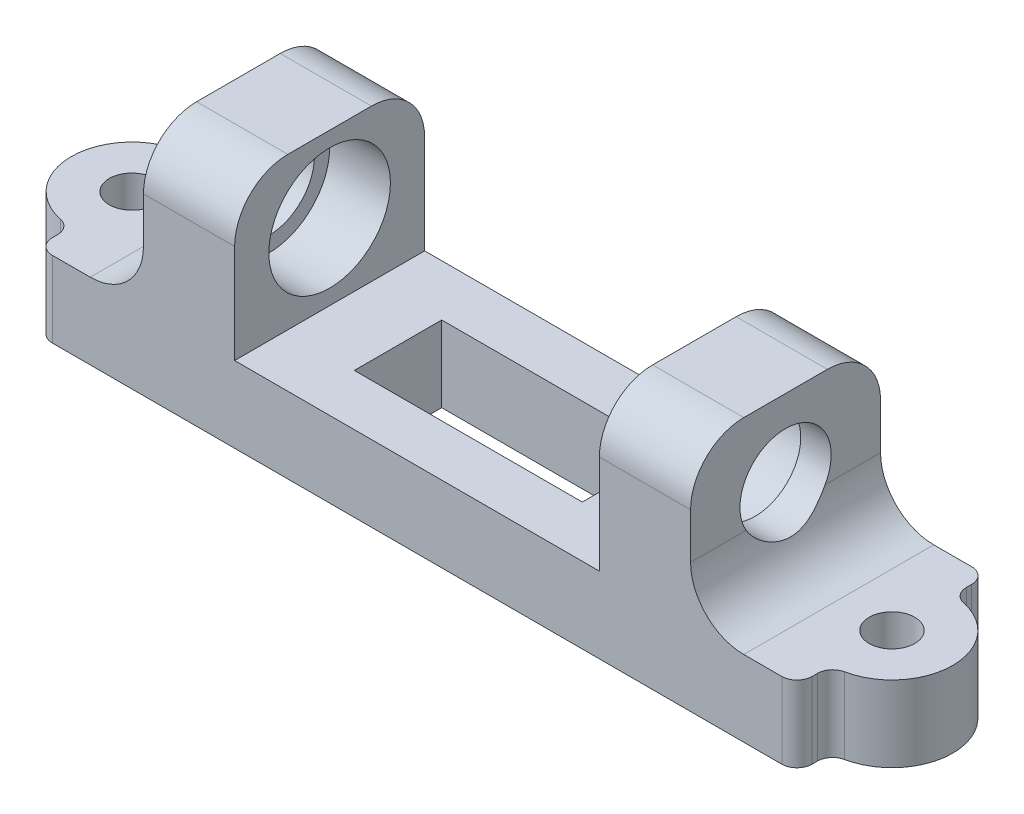
from build123d import *

# Parameters (mm, degrees)
SKETCH1_R           = 1.5
BOSS_EXTRUDE1_DEPTH = 5
BOSS_EXTRUDE2_DEPTH = 10
SKETCH3_R           = 4
CUT_EXTRUDE1_DEPTH  = 4
SKETCH3_3_R         = 3
CUT_EXTRUDE2_DEPTH  = 45.102862719
FILLET6_R           = 3.5
FILLET7_R           = 3.5
FILLET8_R           = 3.5
FILLET9_R           = 3.5
FILLET10_R          = 3.5
FILLET11_R          = 3.5
FILLET12_R          = 1
FILLET13_R          = 1
FILLET14_R          = 1
FILLET15_R          = 1
FILLET16_R          = 1
FILLET17_R          = 1
FILLET18_R          = 1
FILLET19_R          = 1
SKETCH4_W           = 15
SKETCH4_H           = 5.75
CUT_EXTRUDE3_DEPTH  = 32.305949934


with BuildPart() as part:
    # Sketch1 → Boss-Extrude1 (new body)
    with BuildSketch(Plane(origin=(0, 0, 0), x_dir=(1, 0, 0), z_dir=(0, 1, 0))):
        with BuildLine():
            Line((-25, -4), (-25, -6.25))
            Line((-25, -6.25), (25, -6.25))
            Line((25, -6.25), (25, -4))
            ThreePointArc((25, -4), (29, 0), (25, 4))
            Line((25, 4), (25, 6.25))
            Line((25, 6.25), (-25, 6.25))
            Line((-25, 6.25), (-25, 4))
            ThreePointArc((-25, 4), (-29, 0), (-25, -4))
        make_face()
        with Locations(Location((25, 0, 0), (0, 0, 270))):
            Circle(SKETCH1_R, mode=Mode.SUBTRACT)
        with Locations(Location((-25, 0, 0), (0, 0, 270))):
            Circle(SKETCH1_R, mode=Mode.SUBTRACT)
    extrude(amount=BOSS_EXTRUDE1_DEPTH)

    # Sketch2 → Boss-Extrude2 (add)
    with BuildSketch(Plane(origin=(0, 5, 0), x_dir=(1, 0, 0), z_dir=(0, 1, 0))):
        Polygon((-18, 0), (-18, -6.25), (-12, -6.25), (-12, 6.25), (-18, 6.25), align=None)
    boss_extrude2 = extrude(amount=BOSS_EXTRUDE2_DEPTH)

    # Sketch3 → Cut-Extrude1 (cut)
    with BuildSketch(Plane(origin=(-12, 0, 0), x_dir=(0, 0, -1), z_dir=(1, 0, 0))):
        with Locations((0, 10)):
            Circle(SKETCH3_R)
    cut_extrude1 = extrude(amount=-CUT_EXTRUDE1_DEPTH, mode=Mode.SUBTRACT)

    # Sketch3<3> → Cut-Extrude2 (cut, through all)
    with BuildSketch(Plane(origin=(-12, 0, 0), x_dir=(0, 0, -1), z_dir=(1, 0, 0))):
        with Locations((0, 10)):
            Circle(SKETCH3_3_R)
    cut_extrude2 = extrude(amount=-CUT_EXTRUDE2_DEPTH, mode=Mode.SUBTRACT)

    # Fillet6
    # the kernel refuses this fillet: 3.5 mm, written as the material it adds along each edge
    with BuildSketch(Plane(origin=(-18, 5, -6.25), x_dir=(0, 1, 0), z_dir=(0, 0, 1))) as fillet6_piece_1_section:
        with BuildLine():
            CenterArc((FILLET6_R, FILLET6_R), FILLET6_R, 180, 90)
            Line((0, FILLET6_R), (0, 0))
            Line((0, 0), (FILLET6_R, 0))
        make_face()
    fillet6_piece_1 = extrude(amount=12.5, mode=Mode.PRIVATE)
    fillet6_piece_1 = fillet6_piece_1 - Plane(origin=(-18.808785758, 10, 0), x_dir=(0, 0, -1), z_dir=(1, 0, 0)) * Cylinder(3, 39, mode=Mode.PRIVATE)
    add(fillet6_piece_1)

    # Fillet7
    fillet7_edges = [part.edges().sort_by_distance(p)[0] for p in [
        (-15, 15, -6.25),
    ]]
    fillet(fillet7_edges, radius=FILLET7_R)

    # Fillet8
    fillet8_edges = [part.edges().sort_by_distance(p)[0] for p in [
        (-15, 15, 6.25),
    ]]
    fillet(fillet8_edges, radius=FILLET8_R)

    # Mirror4: Boss-Extrude2, Cut-Extrude1, Cut-Extrude2 across plane
    add(boss_extrude2.mirror(Plane(origin=(0, 0, 0), x_dir=(0, 0, 1), z_dir=(1, 0, 0))))
    add(cut_extrude1.mirror(Plane(origin=(0, 0, 0), x_dir=(0, 0, 1), z_dir=(1, 0, 0))), mode=Mode.SUBTRACT)
    add(cut_extrude2.mirror(Plane(origin=(0, 0, 0), x_dir=(0, 0, 1), z_dir=(1, 0, 0))), mode=Mode.SUBTRACT)

    # Fillet9
    fillet9_edges = [part.edges().sort_by_distance(p)[0] for p in [
        (15, 15, -6.25),
    ]]
    fillet(fillet9_edges, radius=FILLET9_R)

    # Fillet10
    fillet10_edges = [part.edges().sort_by_distance(p)[0] for p in [
        (15, 15, 6.25),
    ]]
    fillet(fillet10_edges, radius=FILLET10_R)

    # Fillet11
    # the kernel refuses this fillet: 3.5 mm, written as the material it adds along each edge
    with BuildSketch(Plane(origin=(18, 5, -6.25), x_dir=(0, 1, 0), z_dir=(0, 0, 1))) as fillet11_piece_1_section:
        with BuildLine():
            CenterArc((FILLET11_R, -FILLET11_R), FILLET11_R, 90, 90)
            Line((0, -FILLET11_R), (0, 0))
            Line((0, 0), (FILLET11_R, 0))
        make_face()
    fillet11_piece_1 = extrude(amount=12.5, mode=Mode.PRIVATE)
    fillet11_piece_1 = fillet11_piece_1 - Plane(origin=(18.808785758, 10, 0), x_dir=(0, 0, -1), z_dir=(-1, 0, 0)) * Cylinder(3, 39, mode=Mode.PRIVATE)
    add(fillet11_piece_1)

    # Fillet12
    fillet12_edges = [part.edges().sort_by_distance(p)[0] for p in [
        (25, 2.5, -6.25),
    ]]
    fillet(fillet12_edges, radius=FILLET12_R)

    # Fillet13
    fillet13_edges = [part.edges().sort_by_distance(p)[0] for p in [
        (25, 2.5, 6.25),
    ]]
    fillet(fillet13_edges, radius=FILLET13_R)

    # Fillet14
    fillet14_edges = [part.edges().sort_by_distance(p)[0] for p in [
        (-25, 2.5, 6.25),
    ]]
    fillet(fillet14_edges, radius=FILLET14_R)

    # Fillet15
    fillet15_edges = [part.edges().sort_by_distance(p)[0] for p in [
        (-25, 2.5, -6.25),
    ]]
    fillet(fillet15_edges, radius=FILLET15_R)

    # Fillet16
    fillet16_edges = [part.edges().sort_by_distance(p)[0] for p in [
        (-25, 2.5, -4),
    ]]
    fillet(fillet16_edges, radius=FILLET16_R)

    # Fillet17
    fillet17_edges = [part.edges().sort_by_distance(p)[0] for p in [
        (-25, 2.5, 4),
    ]]
    fillet(fillet17_edges, radius=FILLET17_R)

    # Fillet18
    fillet18_edges = [part.edges().sort_by_distance(p)[0] for p in [
        (25, 2.5, 4),
    ]]
    fillet(fillet18_edges, radius=FILLET18_R)

    # Fillet19
    fillet19_edges = [part.edges().sort_by_distance(p)[0] for p in [
        (25, 2.5, -4),
    ]]
    fillet(fillet19_edges, radius=FILLET19_R)

    # Sketch4 → Cut-Extrude3 (cut, through all)
    with BuildSketch(Plane(origin=(0, 5, 0), x_dir=(1, 0, 0), z_dir=(0, 1, 0))):
        Rectangle(SKETCH4_W, SKETCH4_H)
    extrude(amount=-CUT_EXTRUDE3_DEPTH, mode=Mode.SUBTRACT)


solid = part.part
